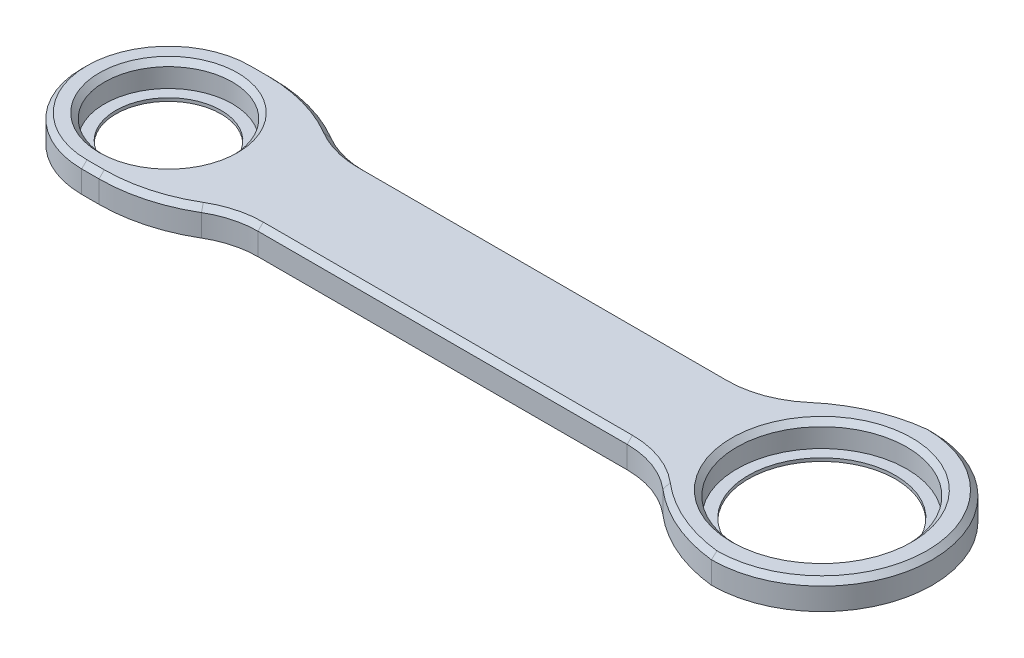
from build123d import *

# Parameters (mm, degrees)
SKETCH1_R           = 12.15
SKETCH1_R_2         = 16.15
BOSS_EXTRUDE1_DEPTH = 5.2
CUT_EXTRUDE1_DEPTH  = 86.894153614
FILLET1_R           = 30
CHAMFER1_SIZE       = 1
SKETCH2_R           = 14.75534968
SKETCH2_R_2         = 10
SKETCH2_R_3         = 19.025242353
SKETCH2_R_4         = 14
BOSS_EXTRUDE2_DEPTH = 0.6


with BuildPart() as part:
    # Sketch1 → Boss-Extrude1 (new body)
    with BuildSketch(Plane(origin=(0, 0, 0), x_dir=(1, 0, 0), z_dir=(0, 1, 0))):
        with BuildLine():
            Line((50.6952797, -21), (62.125, -21))
            ThreePointArc((62.125, -21), (83.125, 0), (62.125, 21))
            Line((62.125, 21), (50.6952797, 21))
            ThreePointArc((50.6952797, 21), (44.646090821, 13.026866227), (35.106613419, 10))
            Line((35.106613419, 10), (-35.106613419, 10))
            ThreePointArc((-35.106613419, 10), (-44.646090821, 13.026866227), (-50.6952797, 21))
            Line((-50.6952797, 21), (-62.125, 21))
            ThreePointArc((-62.125, 21), (-83.125, 0), (-62.125, -21))
            Line((-62.125, -21), (-50.6952797, -21))
            ThreePointArc((-50.6952797, -21), (-44.646090821, -13.026866227), (-35.106613419, -10))
            Line((-35.106613419, -10), (35.106613419, -10))
            ThreePointArc((35.106613419, -10), (44.646090821, -13.026866227), (50.6952797, -21))
        make_face()
        with Locations(Location((-62.125, 0, 0), (0, 0, 270))):
            Circle(SKETCH1_R, mode=Mode.SUBTRACT)
        with Locations(Location((62.125, 0, 0), (0, 0, 270))):
            Circle(SKETCH1_R_2, mode=Mode.SUBTRACT)
    extrude(amount=BOSS_EXTRUDE1_DEPTH)

    # Sketch4 → Cut-Extrude1 (cut, through all)
    with BuildSketch(Plane(origin=(0, 5.2, 0), x_dir=(1, 0, 0), z_dir=(0, 1, 0))):
        with BuildLine():
            Line((-62.125, 16.5), (-40.410985901, 16.5))
            Line((-40.410985901, 16.5), (-43.407950199, 33.342917206))
            Line((-43.407950199, 33.342917206), (-92.984497382, 23.090976894))
            Line((-92.984497382, 23.090976894), (-92.984497382, -9.501012459))
            Line((-92.984497382, -9.501012459), (-86.710921967, -27.097626428))
            Line((-86.710921967, -27.097626428), (-50.736883487, -31.973137348))
            Line((-50.736883487, -31.973137348), (-37.899444956, -29.584754809))
            Line((-37.899444956, -29.584754809), (-38.970543198, -16.5))
            Line((-38.970543198, -16.5), (-62.125, -16.5))
            ThreePointArc((-62.125, -16.5), (-78.625, 0), (-62.125, 16.5))
        make_face()
    extrude(amount=-CUT_EXTRUDE1_DEPTH, mode=Mode.SUBTRACT)

    # Fillet1
    # the kernel refuses this fillet: 30 mm, written as the material it takes off along each edge
    with BuildSketch(Plane(origin=(50.6952797, -28.574300751, -21), x_dir=(1, 0, 0), z_dir=(0, 1, 0))) as fillet1_piece_1:
        with BuildLine():
            CenterArc((14.667456891, -29.824772619), FILLET1_R, 96.195688925, 34.34815674)
            ThreePointArc((-4.833435899, -7.027510056), (-1.956106094, -3.830558257), (0, 0))
            Line((0, 0), (11.4297203, 0))
        make_face()
    extrude(amount=62.348601502, mode=Mode.SUBTRACT)
    with BuildSketch(Plane(origin=(50.6952797, -28.574300751, 21), x_dir=(1, 0, 0), z_dir=(0, 1, 0))) as fillet1_piece_2:
        with BuildLine():
            CenterArc((14.667456891, 29.824772619), FILLET1_R, 229.456154336, 34.34815674)
            ThreePointArc((-4.833435899, 7.027510056), (-1.956106094, 3.830558257), (0, 0))
            Line((0, 0), (11.4297203, 0))
        make_face()
    extrude(amount=62.348601502, mode=Mode.SUBTRACT)
    with BuildSketch(Plane(origin=(-48.253657182, 31.64326437, -16.5), x_dir=(-1, 0, 0), z_dir=(0, -1, 0))) as fillet1_piece_3:
        with BuildLine():
            CenterArc((10.577305748, -30), FILLET1_R, 90, 30.643820853)
            ThreePointArc((-4.713681591, -4.189426465), (-2.15539677, -2.321365496), (0, 0))
            Line((0, 0), (10.577305748, 0))
        make_face()
    extrude(amount=58.086528739, mode=Mode.SUBTRACT)
    with BuildSketch(Plane(origin=(-48.253657182, 31.64326437, 16.5), x_dir=(0.7474496885574631, 0, -0.6643184199428399), z_dir=(0, -1, 0))) as fillet1_piece_4:
        with BuildLine():
            CenterArc((12.023548711, -29.450189698), FILLET1_R, 100.986236803, 30.643820853)
            Line((-7.906003887, -7.026699042), (0, 0))
            ThreePointArc((0, 0), (3.153176503, -0.30323414), (6.306353006, 0))
        make_face()
    extrude(amount=58.086528739, mode=Mode.SUBTRACT)

    # Chamfer1
    # the kernel refuses this chamfer: 1 mm, written as the material it takes off along each edge
    with BuildSketch(Plane(origin=(62.125, 5.2, 0), x_dir=(-0.12235070165055903, 0, 0.9924869297908239), z_dir=(-0.9924869297908239, 0, -0.12235070165055903))) as chamfer1_piece_1:
        Polygon((21, -CHAMFER1_SIZE), (21 - CHAMFER1_SIZE, 0), (21, 0), align=None)
    revolve(axis=Axis((62.125, 5.2, 0), (0, 1, 0)), revolution_arc=194.055575488, mode=Mode.SUBTRACT)
    with BuildSketch(Plane(origin=(35.106613419, 5.2, -26.545750746), x_dir=(0.6500297596931421, 0, 0.7599087520967739), z_dir=(0.7599087520967739, 0, -0.6500297596931421))) as chamfer1_piece_2:
        Polygon((16.545750746 + CHAMFER1_SIZE, 0), (16.545750746, CHAMFER1_SIZE), (16.545750746, 0), align=None)
    revolve(axis=Axis((35.106613419, 5.2, -26.545750746), (0, -1, 0)), revolution_arc=40.543845664, mode=Mode.SUBTRACT)
    with BuildSketch(Plane(origin=(35.106613419, 5.2, -10), x_dir=(0, 0, 1), z_dir=(-1, 0, 0)), Plane(origin=(-35.106613419, 5.2, 10), x_dir=(0, 0, -1), z_dir=(1, 0, 0))) as chamfer1_piece_3:
        Polygon((CHAMFER1_SIZE, 0), (0, -CHAMFER1_SIZE), (0, 0), align=None)
    extrude(amount=70.213226838, mode=Mode.SUBTRACT)
    with BuildSketch(Plane(origin=(-62.125, 5.2, 0), x_dir=(0, 0, 1), z_dir=(1, 0, 0))) as chamfer1_piece_4:
        Polygon((16.5 - CHAMFER1_SIZE, 0), (16.5, CHAMFER1_SIZE), (16.5, 0), align=None)
    revolve(axis=Axis((-62.125, 5.2, 0), (0, -1, 0)), revolution_arc=180, mode=Mode.SUBTRACT)
    with BuildSketch(Plane(origin=(-62.125, 5.2, -16.5), x_dir=(0, 0, 1), z_dir=(1, 0, 0)), Plane(origin=(-58.83096293, 5.2, 16.5), x_dir=(0, 0, -1), z_dir=(-1, 0, 0))) as chamfer1_piece_5:
        Polygon((CHAMFER1_SIZE, 0), (0, CHAMFER1_SIZE), (0, 0), align=None)
    extrude(amount=3.29403707, mode=Mode.SUBTRACT)
    with BuildSketch(Plane(origin=(-35.106613419, 5.2, 26.545750746), x_dir=(-0.5096995779497587, 0, -0.8603524511720982), z_dir=(-0.8603524511720982, 0, 0.5096995779497587))) as chamfer1_piece_6:
        Polygon((16.545750746 + CHAMFER1_SIZE, 0), (16.545750746, CHAMFER1_SIZE), (16.545750746, 0), align=None)
    revolve(axis=Axis((-35.106613419, 5.2, 26.545750746), (0, -1, 0)), revolution_arc=30.643820853, mode=Mode.SUBTRACT)
    with BuildSketch(Plane(origin=(-62.125, 5.2, 0), x_dir=(0, 0, 1), z_dir=(-1, 0, 0))) as chamfer1_piece_7:
        Polygon((12.15 + CHAMFER1_SIZE, 0), (12.15, -CHAMFER1_SIZE), (12.15, 0), align=None)
    revolve(axis=Axis((-62.125, 5.2, 0), (0, 1, 0)), mode=Mode.SUBTRACT)
    with BuildSketch(Plane(origin=(62.125, 5.2, 0), x_dir=(0, 0, 1), z_dir=(-1, 0, 0))) as chamfer1_piece_8:
        Polygon((16.15 + CHAMFER1_SIZE, 0), (16.15, -CHAMFER1_SIZE), (16.15, 0), align=None)
    revolve(axis=Axis((62.125, 5.2, 0), (0, 1, 0)), mode=Mode.SUBTRACT)
    with BuildSketch(Plane(origin=(-35.106613419, 5.2, -26.545750746), x_dir=(0, 0, 1), z_dir=(1, 0, 0))) as chamfer1_piece_9:
        Polygon((16.545750746 + CHAMFER1_SIZE, 0), (16.545750746, CHAMFER1_SIZE), (16.545750746, 0), align=None)
    revolve(axis=Axis((-35.106613419, 5.2, -26.545750746), (0, -1, 0)), revolution_arc=30.643820853, mode=Mode.SUBTRACT)
    with BuildSketch(Plane(origin=(35.106613419, 5.2, 26.545750746), x_dir=(0, 0, -1), z_dir=(-1, 0, 0))) as chamfer1_piece_10:
        Polygon((16.545750746 + CHAMFER1_SIZE, 0), (16.545750746, CHAMFER1_SIZE), (16.545750746, 0), align=None)
    revolve(axis=Axis((35.106613419, 5.2, 26.545750746), (0, -1, 0)), revolution_arc=40.543845664, mode=Mode.SUBTRACT)
    with BuildSketch(Plane(origin=(65.362736591, 5.2, -8.824772619), x_dir=(0.14849692395329253, 0, 0.9889128695574804), z_dir=(0.9889128695574804, 0, -0.14849692395329253))) as chamfer1_piece_11:
        Polygon((30, CHAMFER1_SIZE), (30 - CHAMFER1_SIZE, 0), (30, 0), align=None)
    revolve(axis=Axis((65.362736591, 5.2, -8.824772619), (0, -1, 0)), revolution_arc=49.083676808, mode=Mode.SUBTRACT)
    with BuildSketch(Plane(origin=(65.362736591, 5.2, 8.824772619), x_dir=(-0.6500297596931309, 0, -0.7599087520967833), z_dir=(-0.7599087520967833, 0, 0.6500297596931309))) as chamfer1_piece_12:
        Polygon((30, CHAMFER1_SIZE), (30 - CHAMFER1_SIZE, 0), (30, 0), align=None)
    revolve(axis=Axis((65.362736591, 5.2, 8.824772619), (0, -1, 0)), revolution_arc=49.083676808, mode=Mode.SUBTRACT)
    with BuildSketch(Plane(origin=(-58.83096293, 5.2, -13.5), x_dir=(0, 0, 1), z_dir=(-1, 0, 0))) as chamfer1_piece_13:
        Polygon((30 - CHAMFER1_SIZE, 0), (30, -CHAMFER1_SIZE), (30, 0), align=None)
    revolve(axis=Axis((-58.83096293, 5.2, -13.5), (0, 1, 0)), revolution_arc=30.643820853, mode=Mode.SUBTRACT)
    with BuildSketch(Plane(origin=(-58.83096293, 5.2, 13.5), x_dir=(0.5096995779497117, 0, -0.8603524511721262), z_dir=(0.8603524511721262, 0, 0.5096995779497117))) as chamfer1_piece_14:
        Polygon((30 - CHAMFER1_SIZE, 0), (30, -CHAMFER1_SIZE), (30, 0), align=None)
    revolve(axis=Axis((-58.83096293, 5.2, 13.5), (0, 1, 0)), revolution_arc=30.643820853, mode=Mode.SUBTRACT)

    # Sketch2 → Boss-Extrude2 (add)
    # profile 1 of 2: a face of its own
    with BuildSketch(Plane.XZ):
        with Locations((-62.125, 0)):
            Circle(SKETCH2_R)
        with Locations(Location((-62.125, 0, 0), (0, 0, 270))):
            Circle(SKETCH2_R_2, mode=Mode.SUBTRACT)
    # profile 2 of 2: a face of its own
    with BuildSketch(Plane.XZ):
        with Locations((62.125, 0)):
            Circle(SKETCH2_R_3)
        with Locations(Location((62.125, 0, 0), (0, 0, 270))):
            Circle(SKETCH2_R_4, mode=Mode.SUBTRACT)
    extrude(amount=-BOSS_EXTRUDE2_DEPTH)


solid = part.part
